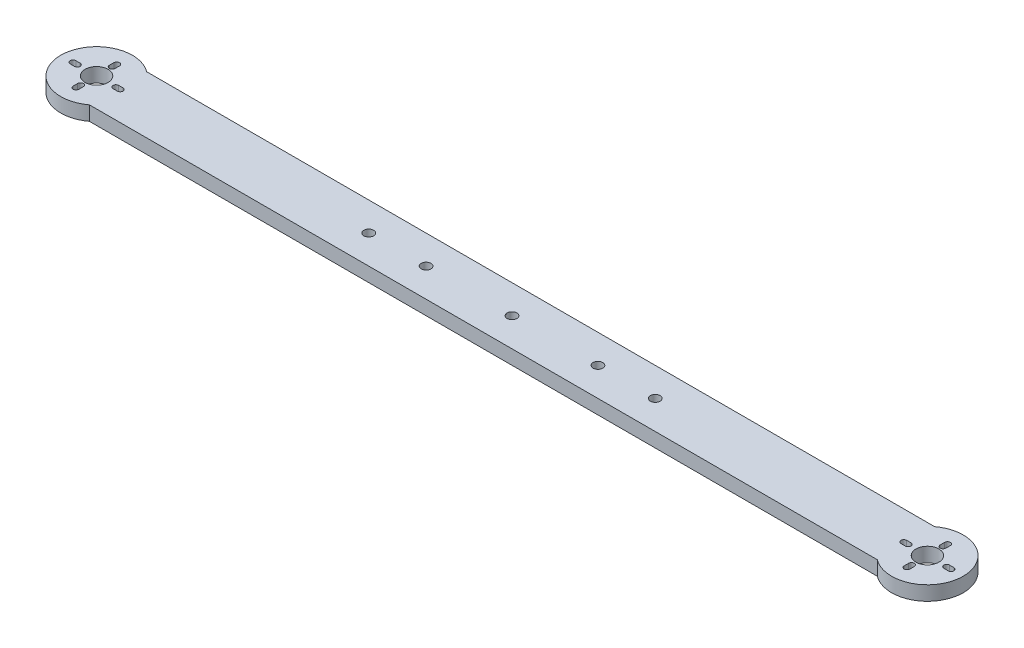
from build123d import *

# Parameters (mm, degrees)
BOSS_EXTRUDE1_DEPTH = 6.35
SKETCH2_R           = 5.08
CUT_EXTRUDE1_DEPTH  = 201.754423986
SKETCH3_R           = 2.159
CUT_EXTRUDE2_DEPTH  = 201.754423986
SKETCH4_R           = 2.159
CUT_EXTRUDE3_DEPTH  = 201.754423986


with BuildPart() as part:
    # Sketch1 → Boss-Extrude1 (new body)
    with BuildSketch(Plane(origin=(0, 0, 0), x_dir=(1, 0, 0), z_dir=(0, 1, 0))):
        with BuildLine():
            Line((-174.625, 12.7), (174.625, 12.7))
            ThreePointArc((174.625, 12.7), (200.025, 0), (174.625, -12.7))
            Line((174.625, -12.7), (-174.625, -12.7))
            ThreePointArc((-174.625, -12.7), (-200.025, 0), (-174.625, 12.7))
        make_face()
    extrude(amount=BOSS_EXTRUDE1_DEPTH)

    # Sketch2 → Cut-Extrude1 (cut, through all)
    with BuildSketch(Plane(origin=(0, 6.35, 0), x_dir=(1, 0, 0), z_dir=(0, 1, 0))):
        with Locations((184.15, 0)):
            Circle(SKETCH2_R)
        with Locations((-184.15, 0)):
            Circle(SKETCH2_R)
        with BuildLine():
            Line((173.691383345, 1.25), (175.608616655, 1.25))
            ThreePointArc((175.608616655, 1.25), (176.858616655, 0), (175.608616655, -1.25))
            Line((175.608616655, -1.25), (173.691383345, -1.25))
            ThreePointArc((173.691383345, -1.25), (172.441383345, 0), (173.691383345, 1.25))
        make_face()
        with BuildLine():
            Line((194.608616655, 1.25), (192.691383345, 1.25))
            ThreePointArc((192.691383345, 1.25), (191.441383345, 0), (192.691383345, -1.25))
            Line((192.691383345, -1.25), (194.608616655, -1.25))
            ThreePointArc((194.608616655, -1.25), (195.858616655, 0), (194.608616655, 1.25))
        make_face()
        with BuildLine():
            Line((185.4, 8.920928665), (185.4, 6.921035691))
            ThreePointArc((185.4, 6.921035691), (184.15, 5.671035691), (182.9, 6.921035691))
            Line((182.9, 6.921035691), (182.9, 8.920928665))
            ThreePointArc((182.9, 8.920928665), (184.15, 10.170928665), (185.4, 8.920928665))
        make_face()
        with BuildLine():
            Line((185.441381345, -9.078964309), (185.441381345, -7.078964309))
            ThreePointArc((185.441381345, -7.078964309), (184.191381345, -5.828964309), (182.941381345, -7.078964309))
            Line((182.941381345, -7.078964309), (182.941381345, -9.078964309))
            ThreePointArc((182.941381345, -9.078964309), (184.191381345, -10.328964309), (185.441381345, -9.078964309))
        make_face()
        with BuildLine():
            Line((-185.441381345, -9.078964309), (-185.441381345, -7.078964309))
            ThreePointArc((-185.441381345, -7.078964309), (-184.191381345, -5.828964309), (-182.941381345, -7.078964309))
            Line((-182.941381345, -7.078964309), (-182.941381345, -9.078964309))
            ThreePointArc((-182.941381345, -9.078964309), (-184.191381345, -10.328964309), (-185.441381345, -9.078964309))
        make_face()
        with BuildLine():
            Line((-185.4, 8.920928665), (-185.4, 6.921035691))
            ThreePointArc((-185.4, 6.921035691), (-184.15, 5.671035691), (-182.9, 6.921035691))
            Line((-182.9, 6.921035691), (-182.9, 8.920928665))
            ThreePointArc((-182.9, 8.920928665), (-184.15, 10.170928665), (-185.4, 8.920928665))
        make_face()
        with BuildLine():
            Line((-194.608616655, 1.25), (-192.691383345, 1.25))
            ThreePointArc((-192.691383345, 1.25), (-191.441383345, 0), (-192.691383345, -1.25))
            Line((-192.691383345, -1.25), (-194.608616655, -1.25))
            ThreePointArc((-194.608616655, -1.25), (-195.858616655, 0), (-194.608616655, 1.25))
        make_face()
        with BuildLine():
            Line((-173.691383345, 1.25), (-175.608616655, 1.25))
            ThreePointArc((-175.608616655, 1.25), (-176.858616655, 0), (-175.608616655, -1.25))
            Line((-175.608616655, -1.25), (-173.691383345, -1.25))
            ThreePointArc((-173.691383345, -1.25), (-172.441383345, 0), (-173.691383345, 1.25))
        make_face()
    extrude(amount=-CUT_EXTRUDE1_DEPTH, mode=Mode.SUBTRACT)

    # Sketch3 → Cut-Extrude2 (cut, through all)
    with BuildSketch(Plane(origin=(0, 6.35, 0), x_dir=(1, 0, 0), z_dir=(0, 1, 0))):
        Circle(SKETCH3_R)
        with Locations((38.1, 0)):
            Circle(SKETCH3_R)
        with Locations((-38.1, 0)):
            Circle(SKETCH3_R)
    extrude(amount=-CUT_EXTRUDE2_DEPTH, mode=Mode.SUBTRACT)

    # Sketch4 → Cut-Extrude3 (cut, through all)
    with BuildSketch(Plane(origin=(0, 6.35, 0), x_dir=(1, 0, 0), z_dir=(0, 1, 0))):
        with Locations((63.5, 0)):
            Circle(SKETCH4_R)
        with Locations((-63.5, 0)):
            Circle(SKETCH4_R)
    extrude(amount=-CUT_EXTRUDE3_DEPTH, mode=Mode.SUBTRACT)


solid = part.part
